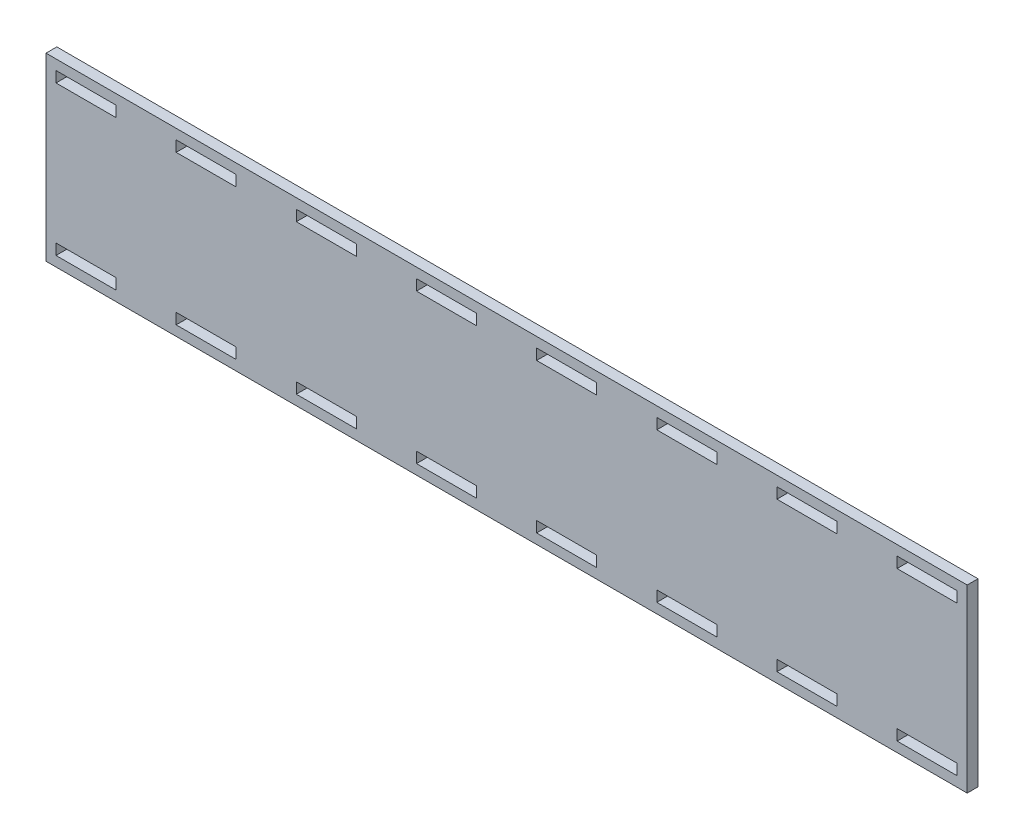
from build123d import *

# Parameters (mm, degrees)
SKETCH1_W           = 460
SKETCH1_H           = 90
SKETCH1_W_2         = 30
SKETCH1_H_2         = 5.4
BOSS_EXTRUDE1_DEPTH = 5.4


with BuildPart() as part:
    # Sketch1 → Boss-Extrude1 (new body)
    with BuildSketch(Plane.XY):
        with Locations((15.553483591, 10.102805507)):
            Rectangle(SKETCH1_W, SKETCH1_H)
        with Locations((-134.446516409, 47.402805507)):
            Rectangle(SKETCH1_W_2, SKETCH1_H_2, mode=Mode.SUBTRACT)
        with Locations((-194.446516409, 47.402805507)):
            Rectangle(SKETCH1_W_2, SKETCH1_H_2, mode=Mode.SUBTRACT)
        with Locations((-74.446516409, 47.402805507)):
            Rectangle(SKETCH1_W_2, SKETCH1_H_2, mode=Mode.SUBTRACT)
        with Locations((-14.446516409, 47.402805507)):
            Rectangle(SKETCH1_W_2, SKETCH1_H_2, mode=Mode.SUBTRACT)
        with Locations((45.553483591, 47.402805507)):
            Rectangle(SKETCH1_W_2, SKETCH1_H_2, mode=Mode.SUBTRACT)
        with Locations((105.553483591, 47.402805507)):
            Rectangle(SKETCH1_W_2, SKETCH1_H_2, mode=Mode.SUBTRACT)
        with Locations((165.553483591, 47.402805507)):
            Rectangle(SKETCH1_W_2, SKETCH1_H_2, mode=Mode.SUBTRACT)
        with Locations((225.553483591, 47.402805507)):
            Rectangle(SKETCH1_W_2, SKETCH1_H_2, mode=Mode.SUBTRACT)
        with Locations((225.553483591, -27.197194493)):
            Rectangle(SKETCH1_W_2, SKETCH1_H_2, mode=Mode.SUBTRACT)
        with Locations((165.553483591, -27.197194493)):
            Rectangle(SKETCH1_W_2, SKETCH1_H_2, mode=Mode.SUBTRACT)
        with Locations((105.553483591, -27.197194493)):
            Rectangle(SKETCH1_W_2, SKETCH1_H_2, mode=Mode.SUBTRACT)
        with Locations((45.553483591, -27.197194493)):
            Rectangle(SKETCH1_W_2, SKETCH1_H_2, mode=Mode.SUBTRACT)
        with Locations((-14.446516409, -27.197194493)):
            Rectangle(SKETCH1_W_2, SKETCH1_H_2, mode=Mode.SUBTRACT)
        with Locations((-74.446516409, -27.197194493)):
            Rectangle(SKETCH1_W_2, SKETCH1_H_2, mode=Mode.SUBTRACT)
        with Locations((-134.446516409, -27.197194493)):
            Rectangle(SKETCH1_W_2, SKETCH1_H_2, mode=Mode.SUBTRACT)
        with Locations((-194.446516409, -27.197194493)):
            Rectangle(SKETCH1_W_2, SKETCH1_H_2, mode=Mode.SUBTRACT)
    extrude(amount=BOSS_EXTRUDE1_DEPTH)


solid = part.part
